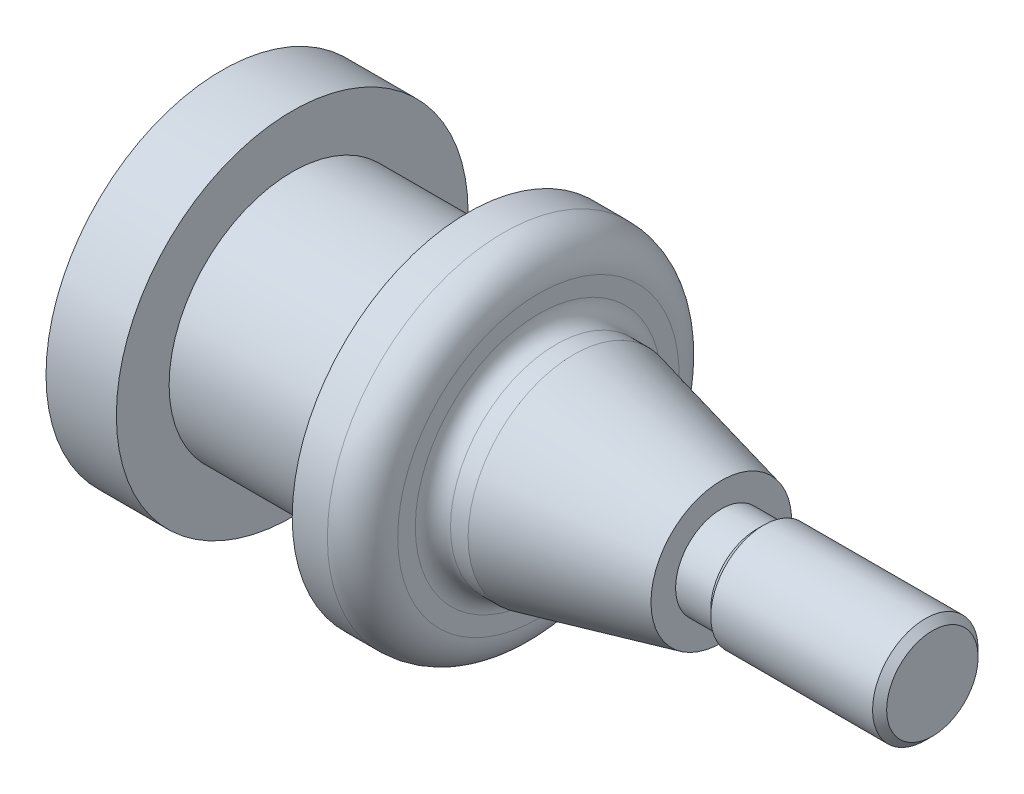
from build123d import *

# Parameters (mm, degrees)
FILLET1_R     = 5
FILLET2_R     = 10
CHAMFER1_SIZE = 2


with BuildPart() as part:
    # Sketch1 → Revolve1 (revolve)
    with BuildSketch(Plane.XY, mode=Mode.PRIVATE) as revolve1_sk:
        Polygon((0, 0), (202, 0), (202, 15), (152, 15), (152, 13), (142, 13), (142, 20), (100, 30), (90, 30), (90, 50), (70, 50), (70, 35), (20, 35), (20, 50), (0, 50), align=None)
    revolve(revolve1_sk.sketch.rotate(Axis((0, 0, 0), (1, 0, 0)), 90), axis=Axis((0, 0, 0), (1, 0, 0)))

    # Fillet1
    fillet1_edges = [part.edges().sort_by_distance(p)[0] for p in [
        (90, 0, -30),
    ]]
    fillet(fillet1_edges, radius=FILLET1_R)

    # Fillet2
    fillet2_edges = [part.edges().sort_by_distance(p)[0] for p in [
        (90, 0, -50),
    ]]
    fillet(fillet2_edges, radius=FILLET2_R)

    # Chamfer1
    chamfer1_edges = [part.edges().sort_by_distance(p)[0] for p in [
        (152, 0, -15),
        (202, 0, -15),
    ]]
    chamfer(chamfer1_edges, length=CHAMFER1_SIZE - 0.0001)  # a hair under: the kernel refuses the full size


solid = part.part
